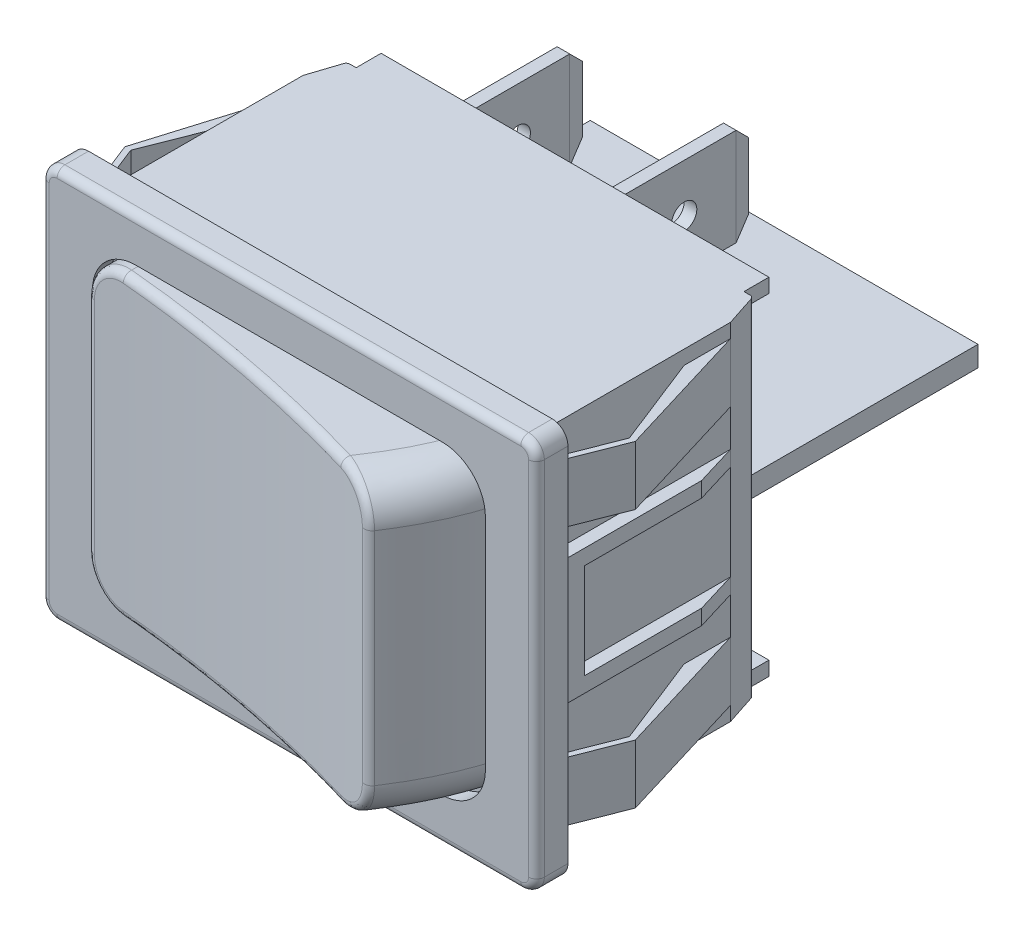
from build123d import *
from OCP.BRepFilletAPI import BRepFilletAPI_MakeFillet

# Parameters (mm, degrees)
SKETCH1_W                = 31.5
SKETCH1_H                = 25
BOSS_EXTRUDE1_DEPTH      = 2
SKETCH2_W                = 25
SKETCH2_H                = 19.45
CUT_EXTRUDE1_DEPTH       = 1
SKETCH3_W                = 24.6
SKETCH3_H                = 19.05
BOSS_EXTRUDE2_DEPTH      = 5.66
FILLET3_R1               = 0.5
FILLET3_R2               = 1
SKETCH5_W                = 27.2
SKETCH5_H                = 22
BOSS_EXTRUDE3_DEPTH      = 16.2
CUT_EXTRUDE3_START       = -19.05
CUT_EXTRUDE3_DEPTH       = 19.05
FILLET4_R1               = 2.5
FILLET4_R2               = 2.75
FILLET4_R3               = 0.5
BOSS_EXTRUDE6_DEPTH      = 21.1
CUT_EXTRUDE4_DEPTH       = 0.9
CUT_EXTRUDE6_DEPTH       = 44.66511631
FILLET6_R                = 0.25
SKETCH13_W               = 12.5
SKETCH13_H               = 12.7
CUT_EXTRUDE7_DEPTH       = 43.634053291
SKETCH14_W               = 25.936088755
SKETCH14_H               = 20.2
CUT_EXTRUDE8_DEPTH       = 0.5
SKETCH15_W               = 8.143044377
SKETCH15_H               = 20.2
SKETCH15_W_2             = 8.143044378
CUT_EXTRUDE9_DEPTH       = 1.086388006
SKETCH16_W               = 12.5
SKETCH16_H               = 8
BOSS_EXTRUDE7_DEPTH      = 0.8
SKETCH17_W               = 10.1
SKETCH17_H               = 6.06
CUT_EXTRUDE10_DEPTH      = 0.8
SKETCH18_W               = 9.090790263
SKETCH18_H               = 20.2
CUT_EXTRUDE11_DEPTH      = 43.122918834
SKETCH21_W               = 3.7
SKETCH21_H               = 4
BOSS_EXTRUDE10_DEPTH     = 0.5
CHAMFER1_SIZE            = 0.5
FILLET6_OF_MIRROR1_R     = 0.25
CHAMFER1_OF_MIRROR1_SIZE = 0.5
SKETCH19_W               = 7.460390076
SKETCH19_H               = 6.06
BOSS_EXTRUDE8_DEPTH      = 0.8
SKETCH20_W               = 24.67217751
SKETCH20_H               = 1.3
BOSS_EXTRUDE9_DEPTH      = 14.89
SKETCH22_W               = 0.8
SKETCH22_H               = 7.48
BOSS_EXTRUDE11_DEPTH     = 11.35
CUT_EXTRUDE12_REACH      = 45.523
CHAMFER2_SIZE            = 1
CHAMFER3_SIZE            = 0.2
CHAMFER3_SIZE2           = 1
CHAMFER4_SIZE            = 0.2
CHAMFER4_SIZE2           = 1
SKETCH24_W               = 0.8
SKETCH24_H               = 7.48
BOSS_EXTRUDE12_DEPTH     = 11.35
CUT_EXTRUDE13_REACH      = 49.965
CHAMFER5_SIZE            = 1
CHAMFER6_SIZE            = 0.2
CHAMFER6_SIZE2           = 1
CHAMFER7_SIZE            = 0.2
CHAMFER7_SIZE2           = 1
CUT_EXTRUDE14_REACH      = 45.523
SKETCH26_R               = 0.8
CUT_EXTRUDE15_REACH      = 49.965
SKETCH27_R               = 0.8


with BuildPart() as part:
    # Sketch1 → Boss-Extrude1 (new body)
    with BuildSketch(Plane.XY):
        with Locations((15.75, 12.5)):
            Rectangle(SKETCH1_W, SKETCH1_H)
    extrude(amount=-BOSS_EXTRUDE1_DEPTH)

    # Sketch2 → Cut-Extrude1 (cut)
    with BuildSketch(Plane.XY):
        with Locations((15.75, 12.5)):
            Rectangle(SKETCH2_W, SKETCH2_H)
    extrude(amount=-CUT_EXTRUDE1_DEPTH, mode=Mode.SUBTRACT)

    # Sketch3 → Boss-Extrude2 (add)
    with BuildSketch(Plane.XY.offset(-1)):
        with Locations((15.75, 12.5)):
            Rectangle(SKETCH3_W, SKETCH3_H)
    extrude(amount=BOSS_EXTRUDE2_DEPTH)

    # Fillet3: one fillet with a radius per group of edges: ONE call of the kernel's fillet builder (fillet() takes one radius for all edges)
    fillet3_edges_1 = [part.edges().sort_by_distance(p)[0] for p in [
        (15.75, 0, 0),
        (31.5, 12.5, 0),
        (0, 12.5, 0),
        (15.75, 25, 0),
    ]]
    fillet3_edges_2 = [part.edges().sort_by_distance(p)[0] for p in [
        (0, 0, -1),
        (31.5, 0, -1),
        (0, 25, -1),
        (31.5, 25, -1),
    ]]
    fillet3 = BRepFilletAPI_MakeFillet(part.part.solid().wrapped)
    for e in fillet3_edges_1:
        fillet3.Add(FILLET3_R1, e.wrapped)
    for e in fillet3_edges_2:
        fillet3.Add(FILLET3_R2, e.wrapped)
    add(Compound.cast(fillet3.Shape()), mode=Mode.REPLACE)

    # Sketch5 → Boss-Extrude3 (add)
    with BuildSketch(Plane(origin=(0, 0, -2), x_dir=(-1, 0, 0), z_dir=(0, 0, -1))):
        with Locations((-15.75, 12.5)):
            Rectangle(SKETCH5_W, SKETCH5_H)
    extrude(amount=BOSS_EXTRUDE3_DEPTH)

    # Sketch7 → Cut-Extrude3 (cut)
    with BuildSketch(Plane.XZ.offset(-2.975).offset(CUT_EXTRUDE3_START)):
        with BuildLine():
            Line((28.05, -1), (28.05, 4.66))
            Line((28.05, 4.66), (28.05, 5.984429768))
            Line((28.05, 5.984429768), (3.45, 5.984429768))
            Line((3.45, 5.984429768), (3.45, 4.66))
            Line((3.45, 4.66), (3.45, 0.509777808))
            add(Edge.make_bspline(
                [(25.326641167, 4.66), (14.748646872, 1.232538912), (3.45, 0.509777808)],
                knots=[0, 0, 0, 1, 1, 1], degree=2))
            add(Edge.make_bspline(
                [(28.05, -1), (27.451008445, 0.998197687), (26.653639835, 2.68002732), (25.326641167, 4.66)],
                knots=[0, 0, 0, 0, 1, 1, 1, 1], degree=3))
        make_face()
    extrude(amount=CUT_EXTRUDE3_DEPTH, mode=Mode.SUBTRACT)

    # Fillet4: one fillet with a radius per group of edges: ONE call of the kernel's fillet builder (fillet() takes one radius for all edges)
    fillet4_edges_1 = [part.edges().sort_by_distance(p)[0] for p in [
        (26.912726524, 22.025, 1.93740461),
        (26.912726524, 2.975, 1.93740461),
        (3.45, 2.975, -0.245111096),
        (3.45, 22.025, -0.245111096),
    ]]
    fillet4_edges_2 = [part.edges().sort_by_distance(p)[0] for p in [
        (28.25, 22.225, -0.5),
        (28.25, 2.775, -0.5),
        (3.25, 2.775, -0.5),
        (3.25, 22.225, -0.5),
    ]]
    fillet4_edges_3 = [part.edges().sort_by_distance(p)[0] for p in [
        (14.51859296, 22.025, 1.899263896),
        (14.51859296, 2.975, 1.899263896),
        (3.45, 12.5, 0.509777808),
        (25.326641167, 12.5, 4.66),
    ]]
    fillet4 = BRepFilletAPI_MakeFillet(part.part.solid().wrapped)
    for e in fillet4_edges_1:
        fillet4.Add(FILLET4_R1, e.wrapped)
    for e in fillet4_edges_2:
        fillet4.Add(FILLET4_R2, e.wrapped)
    for e in fillet4_edges_3:
        fillet4.Add(FILLET4_R3, e.wrapped)
    add(Compound.cast(fillet4.Shape()), mode=Mode.REPLACE)

    # Sketch8 → Boss-Extrude6 (add)
    with BuildSketch(Plane.XZ.offset(-1.5)):
        Polygon((29.35, -14.5), (31.986753232, -5.8), (30.5, -2), (30.12269291, -2), (31.609446142, -5.8), (29.35, -11.538848018), align=None)
    boss_extrude6 = extrude(amount=-BOSS_EXTRUDE6_DEPTH)

    # Sketch10 → Cut-Extrude4 (cut)
    with BuildSketch(Plane.XZ.offset(-1.5)):
        Polygon((30.12269291, -2), (30.5, -2), (31.986753232, -5.8), (29.35, -14.5), (29.35, -11.538848018), (31.609446142, -5.8), align=None)
    cut_extrude4 = extrude(amount=-CUT_EXTRUDE4_DEPTH, mode=Mode.SUBTRACT)

    # Sketch12 → Cut-Extrude6 (cut, through all)
    with BuildSketch(Plane.XZ.offset(-1.5)):
        Polygon((29.35, -18.2), (29.35, -14.5), (28.657551742, -16.613611994), (28.086088755, -16.613611994), (28.086088755, -18.2), (28.657551742, -18.2), align=None)
    cut_extrude6 = extrude(amount=-CUT_EXTRUDE6_DEPTH, mode=Mode.SUBTRACT)

    # Fillet6
    fillet6_edges = [part.edges().sort_by_distance(p)[0] for p in [
        (28.657551742, 12.5, -16.613611994),
    ]]
    fillet(fillet6_edges, radius=FILLET6_R)

    # Sketch13 → Cut-Extrude7 (cut, through all)
    with BuildSketch(Plane(origin=(29.35, 0, 0), x_dir=(0, 0, -1), z_dir=(1, 0, 0))):
        with Locations((8.25, 12.5)):
            Rectangle(SKETCH13_W, SKETCH13_H)
    cut_extrude7 = extrude(amount=CUT_EXTRUDE7_DEPTH, mode=Mode.SUBTRACT)

    # Sketch14 → Cut-Extrude8 (cut)
    with BuildSketch(Plane(origin=(0, 0, -18.2), x_dir=(-1, 0, 0), z_dir=(0, 0, -1))):
        with Locations((-15.118044378, 12.5)):
            Rectangle(SKETCH14_W, SKETCH14_H)
    extrude(amount=-CUT_EXTRUDE8_DEPTH, mode=Mode.SUBTRACT)

    # Sketch15 → Cut-Extrude9 (cut)
    with BuildSketch(Plane(origin=(0, 0, -17.7), x_dir=(-1, 0, 0), z_dir=(0, 0, -1))):
        with Locations((-6.221522189, 12.5)):
            Rectangle(SKETCH15_W, SKETCH15_H)
        with Locations((-24.014566566, 12.5)):
            Rectangle(SKETCH15_W_2, SKETCH15_H)
    extrude(amount=-CUT_EXTRUDE9_DEPTH, mode=Mode.SUBTRACT)

    # Sketch16 → Boss-Extrude7 (add)
    with BuildSketch(Plane(origin=(29.35, 0, 0), x_dir=(0, 0, -1), z_dir=(1, 0, 0))):
        with Locations((8.25, 12.5)):
            Rectangle(SKETCH16_W, SKETCH16_H)
    boss_extrude7 = extrude(amount=BOSS_EXTRUDE7_DEPTH)

    # Sketch17 → Cut-Extrude10 (cut)
    with BuildSketch(Plane(origin=(30.15, 0, 0), x_dir=(0, 0, -1), z_dir=(1, 0, 0))):
        with Locations((9.45, 12.5)):
            Rectangle(SKETCH17_W, SKETCH17_H)
    cut_extrude10 = extrude(amount=-CUT_EXTRUDE10_DEPTH, mode=Mode.SUBTRACT)

    # Sketch18 → Cut-Extrude11 (cut, through all)
    with BuildSketch(Plane(origin=(30.905755772, 0, -9.366764532), x_dir=(-0.290046646775877, 0, -0.9570125091627956), z_dir=(0.9570125091627956, 0, -0.290046646775877))):
        with Locations((0.818417168, 12.5)):
            Rectangle(SKETCH18_W, SKETCH18_H)
    cut_extrude11 = extrude(amount=CUT_EXTRUDE11_DEPTH, mode=Mode.SUBTRACT)

    # Sketch21 → Boss-Extrude10 (add)
    with BuildSketch(Plane(origin=(0, 0, -16.613611994), x_dir=(-1, 0, 0), z_dir=(0, 0, -1))):
        with Locations((-25.246380709, 17.86)):
            Rectangle(SKETCH21_W, SKETCH21_H)
        with Locations((-25.246380709, 7.14)):
            Rectangle(SKETCH21_W, SKETCH21_H)
    boss_extrude10 = extrude(amount=BOSS_EXTRUDE10_DEPTH)

    # Chamfer1
    chamfer1_edges = [part.edges().sort_by_distance(p)[0] for p in [
        (23.396380709, 17.86, -17.113611994),
        (23.396380709, 7.14, -17.113611994),
        (27.096380709, 7.14, -17.113611994),
        (27.096380709, 17.86, -17.113611994),
    ]]
    chamfer(chamfer1_edges, length=CHAMFER1_SIZE - 0.0001)  # a hair under: the kernel refuses the full size

    # Mirror1: Boss-Extrude6, Cut-Extrude4, Cut-Extrude6, Cut-Extrude7, Boss-Extrude7, Cut-Extrude10, Cut-Extrude11, Boss-Extrude10 across plane
    add(boss_extrude6.mirror(Plane.ZY.offset(-15.75)))
    add(cut_extrude4.mirror(Plane.ZY.offset(-15.75)), mode=Mode.SUBTRACT)
    add(cut_extrude6.mirror(Plane.ZY.offset(-15.75)), mode=Mode.SUBTRACT)
    add(cut_extrude7.mirror(Plane.ZY.offset(-15.75)), mode=Mode.SUBTRACT)
    add(boss_extrude7.mirror(Plane.ZY.offset(-15.75)))
    add(cut_extrude10.mirror(Plane.ZY.offset(-15.75)), mode=Mode.SUBTRACT)
    add(cut_extrude11.mirror(Plane.ZY.offset(-15.75)), mode=Mode.SUBTRACT)
    add(boss_extrude10.mirror(Plane.ZY.offset(-15.75)))

    # Fillet6 of Mirror1
    fillet6_of_mirror1_edges = [part.edges().sort_by_distance(p)[0] for p in [
        (2.842448258, 12.5, -16.613611994),
    ]]
    fillet(fillet6_of_mirror1_edges, radius=FILLET6_OF_MIRROR1_R)

    # Chamfer1 of Mirror1
    chamfer1_of_mirror1_edges = [part.edges().sort_by_distance(p)[0] for p in [
        (8.103619291, 17.86, -17.113611994),
        (8.103619291, 7.14, -17.113611994),
        (4.403619291, 7.14, -17.113611994),
        (4.403619291, 17.86, -17.113611994),
    ]]
    chamfer(chamfer1_of_mirror1_edges, length=CHAMFER1_OF_MIRROR1_SIZE - 0.0001)  # a hair under: the kernel refuses the full size

    # Sketch19 → Boss-Extrude8 (add)
    with BuildSketch(Plane.ZY.offset(-2.15)):
        with Locations((-8.130195038, 12.5)):
            Rectangle(SKETCH19_W, SKETCH19_H)
    extrude(amount=BOSS_EXTRUDE8_DEPTH)

    # Sketch20 → Boss-Extrude9 (add)
    with BuildSketch(Plane(origin=(0, 0, -16.613611994), x_dir=(-1, 0, 0), z_dir=(0, 0, -1))):
        with Locations((-15.75, 12.5)):
            Rectangle(SKETCH20_W, SKETCH20_H)
    extrude(amount=BOSS_EXTRUDE9_DEPTH)

    # Sketch22 → Boss-Extrude11 (add)
    with BuildSketch(Plane(origin=(0, 0, -17.7), x_dir=(-1, 0, 0), z_dir=(0, 0, -1))):
        with Locations((-15.75, 17.6)):
            Rectangle(SKETCH22_W, SKETCH22_H)
        with Locations((-15.75, 7.4)):
            Rectangle(SKETCH22_W, SKETCH22_H)
    extrude(amount=BOSS_EXTRUDE11_DEPTH)

    # Sketch23 → Cut-Extrude12 (cut, up to next)
    with BuildSketch(Plane.ZY.offset(-15.35), mode=Mode.PRIVATE) as cut_extrude12_sk1:
        Polygon((-17.7, 11.14), (-19.5, 10.5), (-29.05, 10.5), (-29.05, 11.14), align=None)
    cut_extrude12_tool1 = extrude(cut_extrude12_sk1.sketch, amount=-CUT_EXTRUDE12_REACH, mode=Mode.PRIVATE) & part.part
    # Sketch23 → Cut-Extrude12 (cut, up to next)
    with BuildSketch(Plane.ZY.offset(-15.35), mode=Mode.PRIVATE) as cut_extrude12_sk2:
        Polygon((-17.7, 3.66), (-19.5, 4.3), (-29.05, 4.3), (-29.05, 3.66), align=None)
    cut_extrude12_tool2 = extrude(cut_extrude12_sk2.sketch, amount=-CUT_EXTRUDE12_REACH, mode=Mode.PRIVATE) & part.part
    # Sketch23 → Cut-Extrude12 (cut, up to next)
    with BuildSketch(Plane.ZY.offset(-15.35), mode=Mode.PRIVATE) as cut_extrude12_sk3:
        Polygon((-17.7, 13.86), (-19.5, 14.5), (-29.05, 14.5), (-29.05, 13.86), align=None)
    cut_extrude12_tool3 = extrude(cut_extrude12_sk3.sketch, amount=-CUT_EXTRUDE12_REACH, mode=Mode.PRIVATE) & part.part
    # Sketch23 → Cut-Extrude12 (cut, up to next)
    with BuildSketch(Plane.ZY.offset(-15.35), mode=Mode.PRIVATE) as cut_extrude12_sk4:
        Polygon((-17.7, 21.34), (-19.5, 20.7), (-29.05, 20.7), (-29.05, 21.34), align=None)
    cut_extrude12_tool4 = extrude(cut_extrude12_sk4.sketch, amount=-CUT_EXTRUDE12_REACH, mode=Mode.PRIVATE) & part.part
    add(cut_extrude12_tool1.solids().sort_by_distance((15.35, 10.829187, -23.812081))[0], mode=Mode.SUBTRACT)
    add(cut_extrude12_tool2.solids().sort_by_distance((15.35, 3.970813, -23.812081))[0], mode=Mode.SUBTRACT)
    add(cut_extrude12_tool3.solids().sort_by_distance((15.35, 14.170813, -23.812081))[0], mode=Mode.SUBTRACT)
    add(cut_extrude12_tool4.solids().sort_by_distance((15.35, 21.029187, -23.812081))[0], mode=Mode.SUBTRACT)

    # Chamfer2
    chamfer2_edges = [part.edges().sort_by_distance(p)[0] for p in [
        (15.75, 10.5, -29.05),
        (15.75, 4.3, -29.05),
        (15.75, 14.5, -29.05),
        (15.75, 20.7, -29.05),
    ]]
    chamfer(chamfer2_edges, length=CHAMFER2_SIZE)

    # Chamfer3
    chamfer3_edges = [part.edges().sort_by_distance(p)[0] for p in [
        (16.15, 7.4, -29.05),
        (15.35, 7.4, -29.05),
    ]]
    chamfer3_side = [part.faces().sort_by_distance(p)[0] for p in [
        (15.75, 7.4, -29.05),
    ]]
    chamfer(chamfer3_edges, length=CHAMFER3_SIZE, length2=CHAMFER3_SIZE2, reference=chamfer3_side[0])

    # Chamfer4
    chamfer4_edges = [part.edges().sort_by_distance(p)[0] for p in [
        (16.15, 17.6, -29.05),
        (15.35, 17.6, -29.05),
    ]]
    chamfer4_side = [part.faces().sort_by_distance(p)[0] for p in [
        (15.75, 17.6, -29.05),
    ]]
    chamfer(chamfer4_edges, length=CHAMFER4_SIZE, length2=CHAMFER4_SIZE2, reference=chamfer4_side[0])

    # Sketch24 → Boss-Extrude12 (add)
    with BuildSketch(Plane(origin=(0, 0, -16.613611994), x_dir=(-1, 0, 0), z_dir=(0, 0, -1))):
        with Locations((-6.25, 17.6)):
            Rectangle(SKETCH24_W, SKETCH24_H)
        with Locations((-6.25, 7.4)):
            Rectangle(SKETCH24_W, SKETCH24_H)
    extrude(amount=BOSS_EXTRUDE12_DEPTH)

    # Sketch25 → Cut-Extrude13 (cut, up to next)
    with BuildSketch(Plane.ZY.offset(-5.85), mode=Mode.PRIVATE) as cut_extrude13_sk1:
        Polygon((-16.613611994, 3.66), (-18.413611994, 4.3), (-27.963611994, 4.3), (-27.963611994, 3.66), align=None)
    cut_extrude13_tool1 = extrude(cut_extrude13_sk1.sketch, amount=-CUT_EXTRUDE13_REACH, mode=Mode.PRIVATE) & part.part
    # Sketch25 → Cut-Extrude13 (cut, up to next)
    with BuildSketch(Plane.ZY.offset(-5.85), mode=Mode.PRIVATE) as cut_extrude13_sk2:
        Polygon((-16.613611994, 11.14), (-18.413611994, 10.5), (-27.963611994, 10.5), (-27.963611994, 11.14), align=None)
    cut_extrude13_tool2 = extrude(cut_extrude13_sk2.sketch, amount=-CUT_EXTRUDE13_REACH, mode=Mode.PRIVATE) & part.part
    # Sketch25 → Cut-Extrude13 (cut, up to next)
    with BuildSketch(Plane.ZY.offset(-5.85), mode=Mode.PRIVATE) as cut_extrude13_sk3:
        Polygon((-16.613611994, 13.86), (-18.413611994, 14.5), (-27.963611994, 14.5), (-27.963611994, 13.86), align=None)
    cut_extrude13_tool3 = extrude(cut_extrude13_sk3.sketch, amount=-CUT_EXTRUDE13_REACH, mode=Mode.PRIVATE) & part.part
    # Sketch25 → Cut-Extrude13 (cut, up to next)
    with BuildSketch(Plane.ZY.offset(-5.85), mode=Mode.PRIVATE) as cut_extrude13_sk4:
        Polygon((-16.613611994, 21.34), (-18.413611994, 20.7), (-27.963611994, 20.7), (-27.963611994, 21.34), align=None)
    cut_extrude13_tool4 = extrude(cut_extrude13_sk4.sketch, amount=-CUT_EXTRUDE13_REACH, mode=Mode.PRIVATE) & part.part
    add(cut_extrude13_tool1.solids().sort_by_distance((5.85, 3.970813, -22.725693))[0], mode=Mode.SUBTRACT)
    add(cut_extrude13_tool2.solids().sort_by_distance((5.85, 10.829187, -22.725693))[0], mode=Mode.SUBTRACT)
    add(cut_extrude13_tool3.solids().sort_by_distance((5.85, 14.170813, -22.725693))[0], mode=Mode.SUBTRACT)
    add(cut_extrude13_tool4.solids().sort_by_distance((5.85, 21.029187, -22.725693))[0], mode=Mode.SUBTRACT)

    # Chamfer5
    chamfer5_edges = [part.edges().sort_by_distance(p)[0] for p in [
        (6.25, 4.3, -27.963611994),
        (6.25, 10.5, -27.963611994),
        (6.25, 14.5, -27.963611994),
        (6.25, 20.7, -27.963611994),
    ]]
    chamfer(chamfer5_edges, length=CHAMFER5_SIZE)

    # Chamfer6
    chamfer6_edges = [part.edges().sort_by_distance(p)[0] for p in [
        (6.65, 7.4, -27.963611994),
        (5.85, 7.4, -27.963611994),
    ]]
    chamfer6_side = [part.faces().sort_by_distance(p)[0] for p in [
        (6.25, 7.4, -27.963611994),
    ]]
    chamfer(chamfer6_edges, length=CHAMFER6_SIZE, length2=CHAMFER6_SIZE2, reference=chamfer6_side[0])

    # Chamfer7
    chamfer7_edges = [part.edges().sort_by_distance(p)[0] for p in [
        (6.65, 17.6, -27.963611994),
        (5.85, 17.6, -27.963611994),
    ]]
    chamfer7_side = [part.faces().sort_by_distance(p)[0] for p in [
        (6.25, 17.6, -27.963611994),
    ]]
    chamfer(chamfer7_edges, length=CHAMFER7_SIZE, length2=CHAMFER7_SIZE2, reference=chamfer7_side[0])

    # Sketch26 → Cut-Extrude14 (cut, up to next)
    with BuildSketch(Plane(origin=(16.15, 0, 0), x_dir=(0, 0, -1), z_dir=(1, 0, 0)), mode=Mode.PRIVATE) as cut_extrude14_sk1:
        with Locations((24.75, 17.6)):
            Circle(SKETCH26_R)
    cut_extrude14_tool1 = extrude(cut_extrude14_sk1.sketch, amount=-CUT_EXTRUDE14_REACH, mode=Mode.PRIVATE) & part.part
    # Sketch26 → Cut-Extrude14 (cut, up to next)
    with BuildSketch(Plane(origin=(16.15, 0, 0), x_dir=(0, 0, -1), z_dir=(1, 0, 0)), mode=Mode.PRIVATE) as cut_extrude14_sk2:
        with Locations((24.75, 7.4)):
            Circle(SKETCH26_R)
    cut_extrude14_tool2 = extrude(cut_extrude14_sk2.sketch, amount=-CUT_EXTRUDE14_REACH, mode=Mode.PRIVATE) & part.part
    add(cut_extrude14_tool1.solids().sort_by_distance((16.15, 17.6, -24.75))[0], mode=Mode.SUBTRACT)
    add(cut_extrude14_tool2.solids().sort_by_distance((16.15, 7.4, -24.75))[0], mode=Mode.SUBTRACT)

    # Sketch27 → Cut-Extrude15 (cut, up to next)
    with BuildSketch(Plane.ZY.offset(-5.85), mode=Mode.PRIVATE) as cut_extrude15_sk1:
        with Locations(Location((-23.663611994, 7.4, 0), (0, 0, 270))):
            Circle(SKETCH27_R)
    cut_extrude15_tool1 = extrude(cut_extrude15_sk1.sketch, amount=-CUT_EXTRUDE15_REACH, mode=Mode.PRIVATE) & part.part
    # Sketch27 → Cut-Extrude15 (cut, up to next)
    with BuildSketch(Plane.ZY.offset(-5.85), mode=Mode.PRIVATE) as cut_extrude15_sk2:
        with Locations(Location((-23.663611994, 17.6, 0), (0, 0, 270))):
            Circle(SKETCH27_R)
    cut_extrude15_tool2 = extrude(cut_extrude15_sk2.sketch, amount=-CUT_EXTRUDE15_REACH, mode=Mode.PRIVATE) & part.part
    add(cut_extrude15_tool1.solids().sort_by_distance((5.85, 7.4, -23.663612))[0], mode=Mode.SUBTRACT)
    add(cut_extrude15_tool2.solids().sort_by_distance((5.85, 17.6, -23.663612))[0], mode=Mode.SUBTRACT)


solid = part.part
